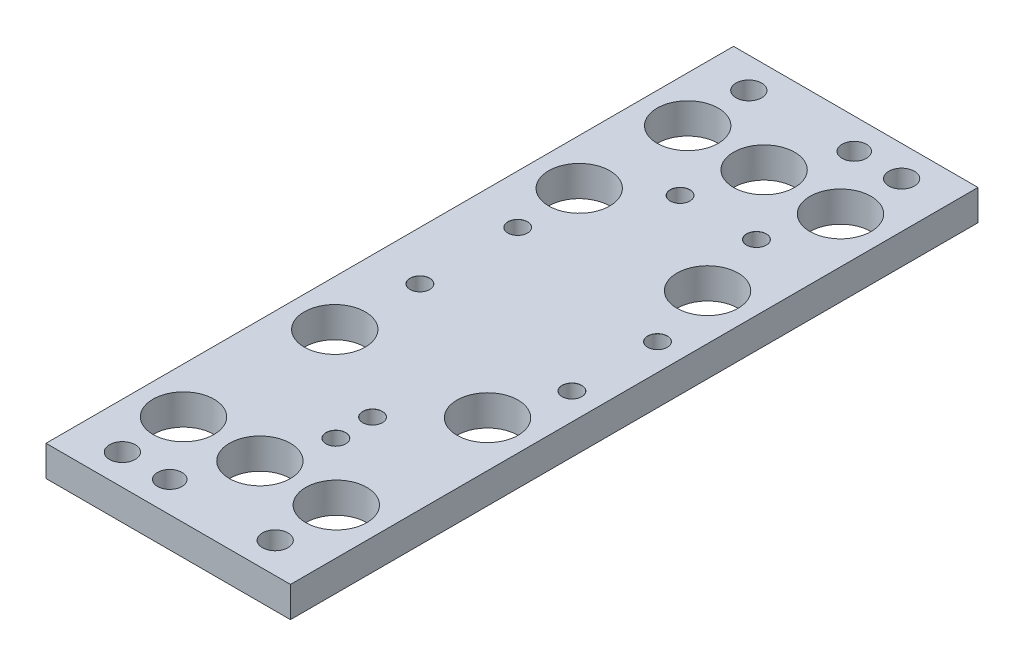
from build123d import *

# Parameters (mm, degrees)
SKETCH1_W                      = 80
SKETCH1_H                      = 225
BOSS_EXTRUDE1_DEPTH            = 10
CUT_EXTRUDE1_REACH             = 121.818
SKETCH2_R                      = 10
M8_CLEARANCE_HOLE1_D           = 8.4
F_8_0MM_DOWEL_HOLE1_D          = 8
M6_CLEARANCE_HOLE1_D           = 6.4
M6_CLEARANCE_HOLE1_CSINK_D     = 6.45
M6_CLEARANCE_HOLE1_CSINK_ANGLE = 90


with BuildPart() as part:
    # Sketch1 → Boss-Extrude1 (new body)
    with BuildSketch(Plane(origin=(0, 0, 0), x_dir=(1, 0, 0), z_dir=(0, 1, 0))):
        Rectangle(SKETCH1_W, SKETCH1_H)
    extrude(amount=-BOSS_EXTRUDE1_DEPTH)

    # Sketch2 → Cut-Extrude1 (cut, up to next)
    with BuildSketch(Plane(origin=(0, 0, 0), x_dir=(1, 0, 0), z_dir=(0, 1, 0)), mode=Mode.PRIVATE) as cut_extrude1_sk1:
        with Locations((25, -82.5)):
            Circle(SKETCH2_R)
    cut_extrude1_tool1 = extrude(cut_extrude1_sk1.sketch, amount=-CUT_EXTRUDE1_REACH, mode=Mode.PRIVATE) & part.part
    # Sketch2 → Cut-Extrude1 (cut, up to next)
    with BuildSketch(Plane(origin=(0, 0, 0), x_dir=(1, 0, 0), z_dir=(0, 1, 0)), mode=Mode.PRIVATE) as cut_extrude1_sk2:
        with Locations((0, -82.5)):
            Circle(SKETCH2_R)
    cut_extrude1_tool2 = extrude(cut_extrude1_sk2.sketch, amount=-CUT_EXTRUDE1_REACH, mode=Mode.PRIVATE) & part.part
    # Sketch2 → Cut-Extrude1 (cut, up to next)
    with BuildSketch(Plane(origin=(0, 0, 0), x_dir=(1, 0, 0), z_dir=(0, 1, 0)), mode=Mode.PRIVATE) as cut_extrude1_sk3:
        with Locations((-25, -82.5)):
            Circle(SKETCH2_R)
    cut_extrude1_tool3 = extrude(cut_extrude1_sk3.sketch, amount=-CUT_EXTRUDE1_REACH, mode=Mode.PRIVATE) & part.part
    # Sketch2 → Cut-Extrude1 (cut, up to next)
    with BuildSketch(Plane(origin=(0, 0, 0), x_dir=(1, 0, 0), z_dir=(0, 1, 0)), mode=Mode.PRIVATE) as cut_extrude1_sk4:
        with Locations((25, -33)):
            Circle(SKETCH2_R)
    cut_extrude1_tool4 = extrude(cut_extrude1_sk4.sketch, amount=-CUT_EXTRUDE1_REACH, mode=Mode.PRIVATE) & part.part
    # Sketch2 → Cut-Extrude1 (cut, up to next)
    with BuildSketch(Plane(origin=(0, 0, 0), x_dir=(1, 0, 0), z_dir=(0, 1, 0)), mode=Mode.PRIVATE) as cut_extrude1_sk5:
        with Locations((-25, -33)):
            Circle(SKETCH2_R)
    cut_extrude1_tool5 = extrude(cut_extrude1_sk5.sketch, amount=-CUT_EXTRUDE1_REACH, mode=Mode.PRIVATE) & part.part
    # Sketch2 → Cut-Extrude1 (cut, up to next)
    with BuildSketch(Plane(origin=(0, 0, 0), x_dir=(1, 0, 0), z_dir=(0, 1, 0)), mode=Mode.PRIVATE) as cut_extrude1_sk6:
        with Locations((25, 39)):
            Circle(SKETCH2_R)
    cut_extrude1_tool6 = extrude(cut_extrude1_sk6.sketch, amount=-CUT_EXTRUDE1_REACH, mode=Mode.PRIVATE) & part.part
    # Sketch2 → Cut-Extrude1 (cut, up to next)
    with BuildSketch(Plane(origin=(0, 0, 0), x_dir=(1, 0, 0), z_dir=(0, 1, 0)), mode=Mode.PRIVATE) as cut_extrude1_sk7:
        with Locations((-25, 47)):
            Circle(SKETCH2_R)
    cut_extrude1_tool7 = extrude(cut_extrude1_sk7.sketch, amount=-CUT_EXTRUDE1_REACH, mode=Mode.PRIVATE) & part.part
    # Sketch2 → Cut-Extrude1 (cut, up to next)
    with BuildSketch(Plane(origin=(0, 0, 0), x_dir=(1, 0, 0), z_dir=(0, 1, 0)), mode=Mode.PRIVATE) as cut_extrude1_sk8:
        with Locations((-25, 82.5)):
            Circle(SKETCH2_R)
    cut_extrude1_tool8 = extrude(cut_extrude1_sk8.sketch, amount=-CUT_EXTRUDE1_REACH, mode=Mode.PRIVATE) & part.part
    # Sketch2 → Cut-Extrude1 (cut, up to next)
    with BuildSketch(Plane(origin=(0, 0, 0), x_dir=(1, 0, 0), z_dir=(0, 1, 0)), mode=Mode.PRIVATE) as cut_extrude1_sk9:
        with Locations((0, 82.5)):
            Circle(SKETCH2_R)
    cut_extrude1_tool9 = extrude(cut_extrude1_sk9.sketch, amount=-CUT_EXTRUDE1_REACH, mode=Mode.PRIVATE) & part.part
    # Sketch2 → Cut-Extrude1 (cut, up to next)
    with BuildSketch(Plane(origin=(0, 0, 0), x_dir=(1, 0, 0), z_dir=(0, 1, 0)), mode=Mode.PRIVATE) as cut_extrude1_sk10:
        with Locations((25, 82.5)):
            Circle(SKETCH2_R)
    cut_extrude1_tool10 = extrude(cut_extrude1_sk10.sketch, amount=-CUT_EXTRUDE1_REACH, mode=Mode.PRIVATE) & part.part
    add(cut_extrude1_tool1.solids().sort_by_distance((25, 0, 82.5))[0], mode=Mode.SUBTRACT)
    add(cut_extrude1_tool2.solids().sort_by_distance((0, 0, 82.5))[0], mode=Mode.SUBTRACT)
    add(cut_extrude1_tool3.solids().sort_by_distance((-25, 0, 82.5))[0], mode=Mode.SUBTRACT)
    add(cut_extrude1_tool4.solids().sort_by_distance((25, 0, 33))[0], mode=Mode.SUBTRACT)
    add(cut_extrude1_tool5.solids().sort_by_distance((-25, 0, 33))[0], mode=Mode.SUBTRACT)
    add(cut_extrude1_tool6.solids().sort_by_distance((25, 0, -39))[0], mode=Mode.SUBTRACT)
    add(cut_extrude1_tool7.solids().sort_by_distance((-25, 0, -47))[0], mode=Mode.SUBTRACT)
    add(cut_extrude1_tool8.solids().sort_by_distance((-25, 0, -82.5))[0], mode=Mode.SUBTRACT)
    add(cut_extrude1_tool9.solids().sort_by_distance((0, 0, -82.5))[0], mode=Mode.SUBTRACT)
    add(cut_extrude1_tool10.solids().sort_by_distance((25, 0, -82.5))[0], mode=Mode.SUBTRACT)

    # M8 Clearance Hole1 (through all)
    with Locations(Plane(origin=(0, 0, 0), x_dir=(1, 0, 0), z_dir=(0, 1, 0))):
        with Locations((25, -102.5), (-25, -102.5), (25, 102.5), (-25, 102.5)):
            Hole(M8_CLEARANCE_HOLE1_D / 2)

    # Ø8.0mm Dowel Hole1 (through all)
    with Locations(Plane(origin=(0, 0, 0), x_dir=(1, 0, 0), z_dir=(0, 1, 0))):
        with Locations((-9.5, -102.5), (9.5, 102.5)):
            Hole(F_8_0MM_DOWEL_HOLE1_D / 2)

    # M6 Clearance Hole1 (through all)
    with Locations(Plane(origin=(0, 0, 0), x_dir=(1, 0, 0), z_dir=(0, 1, 0))):
        with Locations((-24, -6.14), (-24, 25.86), (31.25, -11.64), (31.25, 16.36), (18.5, 61.5), (-6.5, 61.5), (6, -51.64), (6, -63.64)):
            CounterSinkHole(M6_CLEARANCE_HOLE1_D / 2, M6_CLEARANCE_HOLE1_CSINK_D / 2, counter_sink_angle=M6_CLEARANCE_HOLE1_CSINK_ANGLE)


solid = part.part
